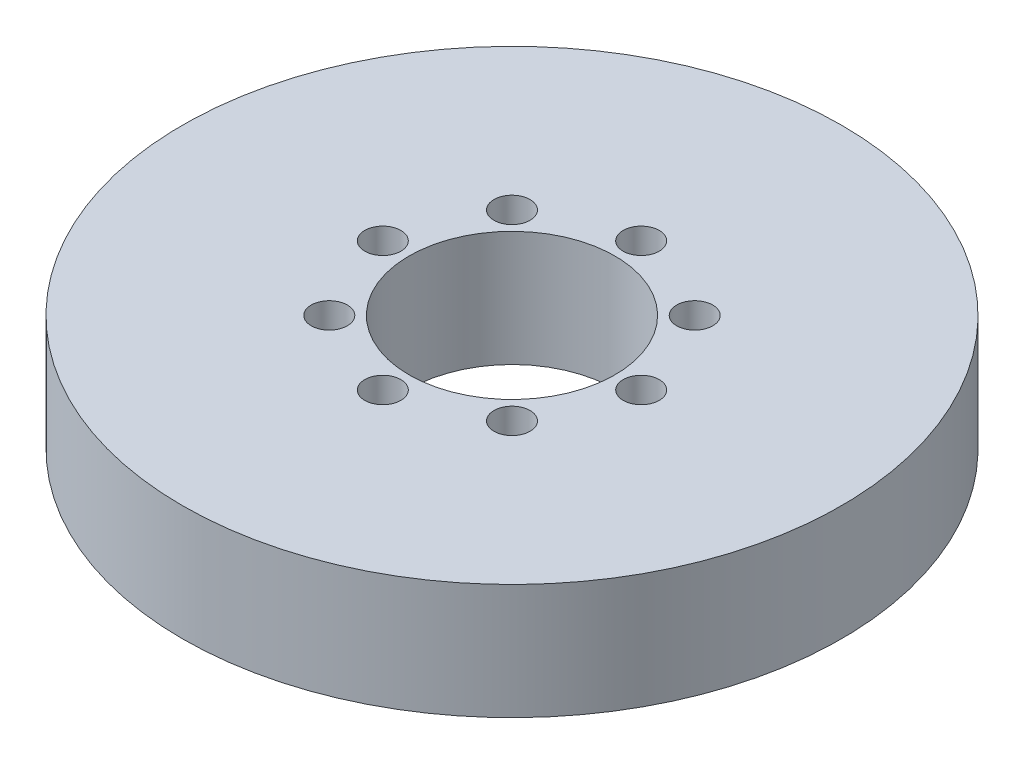
from build123d import *

# Parameters (mm, degrees)
SKETCH1_R           = 40
BOSS_EXTRUDE1_DEPTH = 14
SKETCH2_R           = 12.5
CUT_EXTRUDE1_DEPTH  = 59.275209137
SKETCH3_R           = 2.190364564
CUT_EXTRUDE2_DEPTH  = 11.618632937
CIRPATTERN1_COUNT   = 8


with BuildPart() as part:
    # Sketch1 → Boss-Extrude1 (new body)
    with BuildSketch(Plane(origin=(0, 0, 0), x_dir=(1, 0, 0), z_dir=(0, 1, 0))):
        Circle(SKETCH1_R)
    extrude(amount=BOSS_EXTRUDE1_DEPTH)

    # Sketch2 → Cut-Extrude1 (cut, through all)
    with BuildSketch(Plane(origin=(0, 0, 0), x_dir=(1, 0, 0), z_dir=(0, 1, 0))):
        Circle(SKETCH2_R)
    extrude(amount=CUT_EXTRUDE1_DEPTH, mode=Mode.SUBTRACT)

    # Sketch3 → Cut-Extrude2 (cut)
    with BuildSketch(Plane(origin=(0, 14, 0), x_dir=(1, 0, 0), z_dir=(0, 1, 0))):
        with Locations((-15.681085945, 0)):
            Circle(SKETCH3_R)
    cut_extrude2 = extrude(amount=-CUT_EXTRUDE2_DEPTH, mode=Mode.SUBTRACT)

    # CirPattern1: Cut-Extrude2 ×8 about axis
    cirpattern1_axis = Axis((0, 0, 0), (0, 1, 0))
    for i in range(1, CIRPATTERN1_COUNT):
        add(cut_extrude2.rotate(cirpattern1_axis, i * 360 / CIRPATTERN1_COUNT), mode=Mode.SUBTRACT)


solid = part.part
